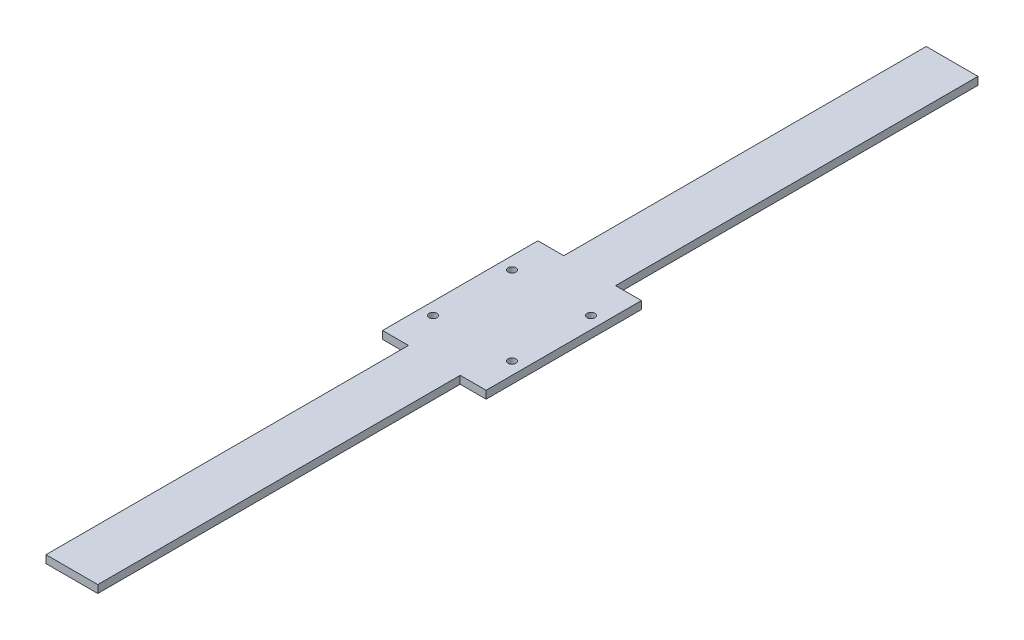
from build123d import *

# Parameters (mm, degrees)
SKETCH1_R           = 1.5
BOSS_EXTRUDE1_DEPTH = 1.5


with BuildPart() as part:
    # Sketch1 → Boss-Extrude1 (new, symmetric)
    with BuildSketch(Plane(origin=(0, 0, 0), x_dir=(1, 0, 0), z_dir=(0, 1, 0))):
        Polygon((-10, 170), (-10, 30), (-20, 30), (-20, -30), (-10, -30), (-10, -170), (10, -170), (10, -30), (20, -30), (20, 30), (10, 30), (10, 170), align=None)
        with Locations((-15.25, 15.25)):
            Circle(SKETCH1_R, mode=Mode.SUBTRACT)
        with Locations((15.25, 15.25)):
            Circle(SKETCH1_R, mode=Mode.SUBTRACT)
        with Locations((15.25, -15.25)):
            Circle(SKETCH1_R, mode=Mode.SUBTRACT)
        with Locations((-15.25, -15.25)):
            Circle(SKETCH1_R, mode=Mode.SUBTRACT)
    extrude(amount=BOSS_EXTRUDE1_DEPTH, both=True)


solid = part.part
